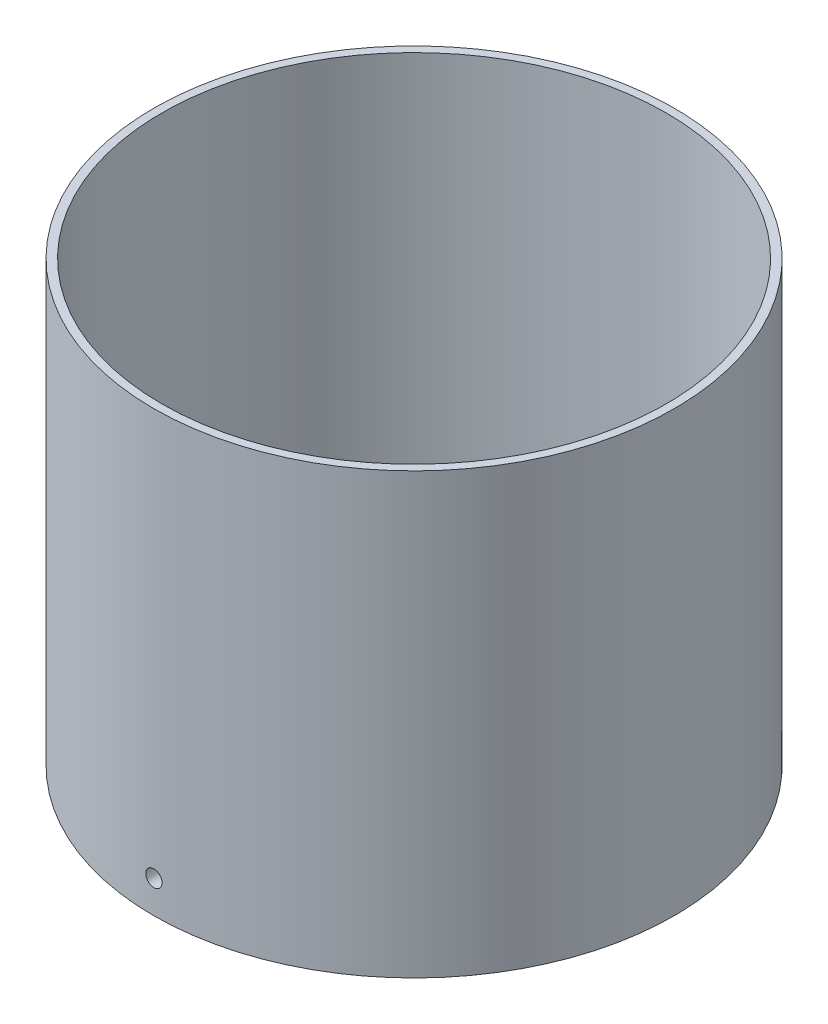
from build123d import *

# Parameters (mm, degrees)
SKETCH1_R               = 101.6
SKETCH1_R_2             = 95.25
BOSS_EXTRUDE1_DEPTH     = 25.4
CUT_EXTRUDE1_DEPTH      = 146.911891222
CUT_EXTRUDE1_DEPTH_BACK = 146.911891222
SKETCH2_R               = 3.175
SKETCH5_R               = 101.6
SKETCH5_R_2             = 98.425
BOSS_EXTRUDE2_DEPTH     = 146.05


with BuildPart() as part:
    # Sketch1 → Boss-Extrude1 (new body)
    with BuildSketch(Plane(origin=(0, 0, 0), x_dir=(1, 0, 0), z_dir=(0, 1, 0))):
        Circle(SKETCH1_R)
        Circle(SKETCH1_R_2, mode=Mode.SUBTRACT)
    extrude(amount=BOSS_EXTRUDE1_DEPTH)

    # Sketch2 → Cut-Extrude1 (cut, two sides: drawn at the far end of the back side and taken through both)
    with BuildSketch(Plane.XY.offset(-CUT_EXTRUDE1_DEPTH_BACK)):
        with Locations((0, 12.7)):
            Circle(SKETCH2_R)
    extrude(amount=CUT_EXTRUDE1_DEPTH + CUT_EXTRUDE1_DEPTH_BACK, mode=Mode.SUBTRACT)

    # Sketch5 → Boss-Extrude2 (add)
    with BuildSketch(Plane(origin=(0, 25.4, 0), x_dir=(1, 0, 0), z_dir=(0, 1, 0))):
        Circle(SKETCH5_R)
        Circle(SKETCH5_R_2, mode=Mode.SUBTRACT)
    extrude(amount=BOSS_EXTRUDE2_DEPTH)


solid = part.part
